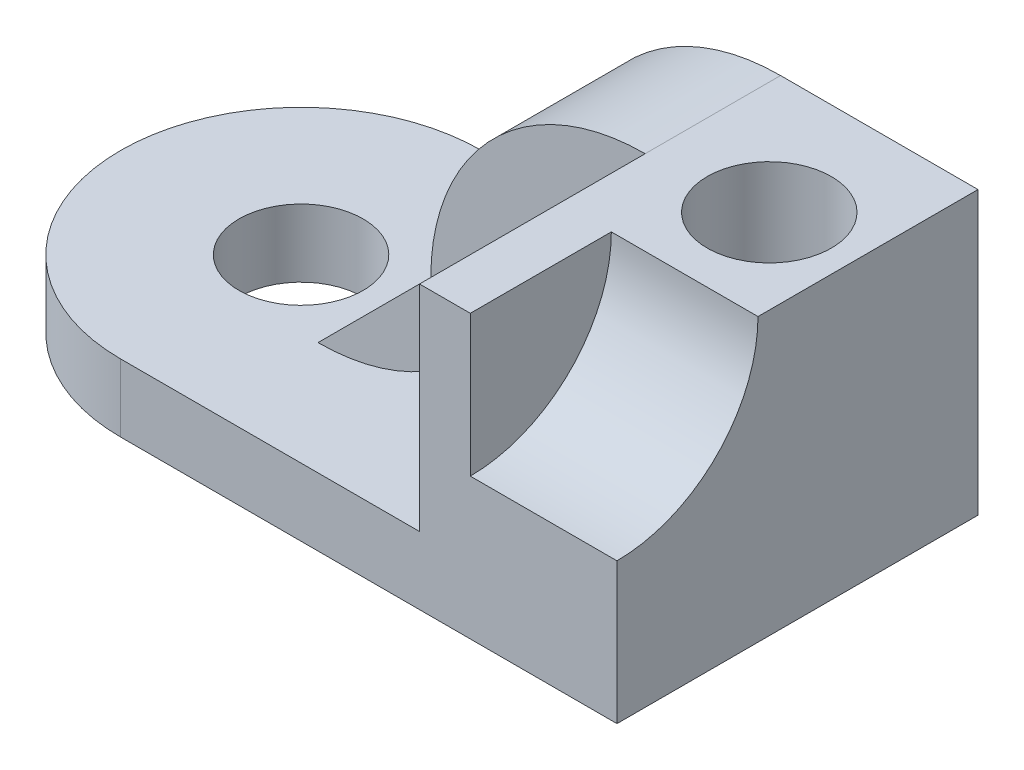
from build123d import *

# Parameters (mm, degrees)
SKETCH1_W           = 26
SKETCH1_H           = 25
BOSS_EXTRUDE1_DEPTH = 32
BOSS_EXTRUDE2_START = -32
BOSS_EXTRUDE2_DEPTH = 24
BOSS_EXTRUDE3_START = 12
BOSS_EXTRUDE3_DEPTH = 44
SKETCH2_R           = 25
CUT_EXTRUDE2_DEPTH  = 26
SKETCH3_R           = 11
CUT_EXTRUDE3_DEPTH  = 130.87686476
FILLET1_R           = 32
SKETCH4_R           = 11
CUT_EXTRUDE4_DEPTH  = 134.880543769


with BuildPart() as part:
    # Sketch1 → Boss-Extrude1 (new, symmetric)
    with BuildSketch(Plane.XY):
        Polygon((120, 12), (85, 12), (47, 12), (0, 12), (0, 0), (120, 0), align=None)
        Polygon((85, 50), (85, 12), (120, 12), (120, 25), (94, 25), (94, 50), align=None)
        with Locations((107, 37.5)):
            Rectangle(SKETCH1_W, SKETCH1_H)
    extrude(amount=BOSS_EXTRUDE1_DEPTH, both=True)

    # Sketch2 → Cut-Extrude2 (cut)
    with BuildSketch(Plane(origin=(120, 0, 0), x_dir=(0, 0, -1), z_dir=(1, 0, 0))):
        with Locations((-32, 50)):
            Circle(SKETCH2_R)
    extrude(amount=-CUT_EXTRUDE2_DEPTH, mode=Mode.SUBTRACT)

    # Sketch3 → Cut-Extrude3 (cut, through all)
    with BuildSketch(Plane(origin=(0, 12, 0), x_dir=(1, 0, 0), z_dir=(0, 1, 0))):
        with Locations(Location((32, 0, 0), (0, 0, 180))):
            Circle(SKETCH3_R)
    extrude(amount=-CUT_EXTRUDE3_DEPTH, mode=Mode.SUBTRACT)

    # Fillet1
    fillet1_edges = [part.edges().sort_by_distance(p)[0] for p in [
        (0, 6, -32),
        (0, 6, 32),
    ]]
    fillet(fillet1_edges, radius=FILLET1_R - 0.0001)  # a hair under: the kernel refuses the full size

    # Sketch4 → Cut-Extrude4 (cut, through all)
    with BuildSketch(Plane(origin=(0, 50, 0), x_dir=(1, 0, 0), z_dir=(0, 1, 0))):
        with Locations(Location((105, 10, 0), (0, 0, 180))):
            Circle(SKETCH4_R)
    extrude(amount=-CUT_EXTRUDE4_DEPTH, mode=Mode.SUBTRACT)


with BuildPart() as body_2:
    # Sketch1<3> → Boss-Extrude2 (new body)
    with BuildSketch(Plane.XY.offset(BOSS_EXTRUDE2_START)):
        with BuildLine():
            ThreePointArc((47, 12), (58.129942315, 38.870057685), (85, 50))
            Line((85, 50), (47, 12))
        make_face()
    extrude(amount=BOSS_EXTRUDE2_DEPTH)


with BuildPart() as body_3:
    # Sketch1<4> → Boss-Extrude3 (new body)
    with BuildSketch(Plane.XY.offset(BOSS_EXTRUDE3_START)):
        with BuildLine():
            Line((47, 12), (85, 50))
            ThreePointArc((85, 50), (73.870057685, 23.129942315), (47, 12))
        make_face()
    extrude(amount=-BOSS_EXTRUDE3_DEPTH)


solid = Compound([part.part, body_2.part, body_3.part])
